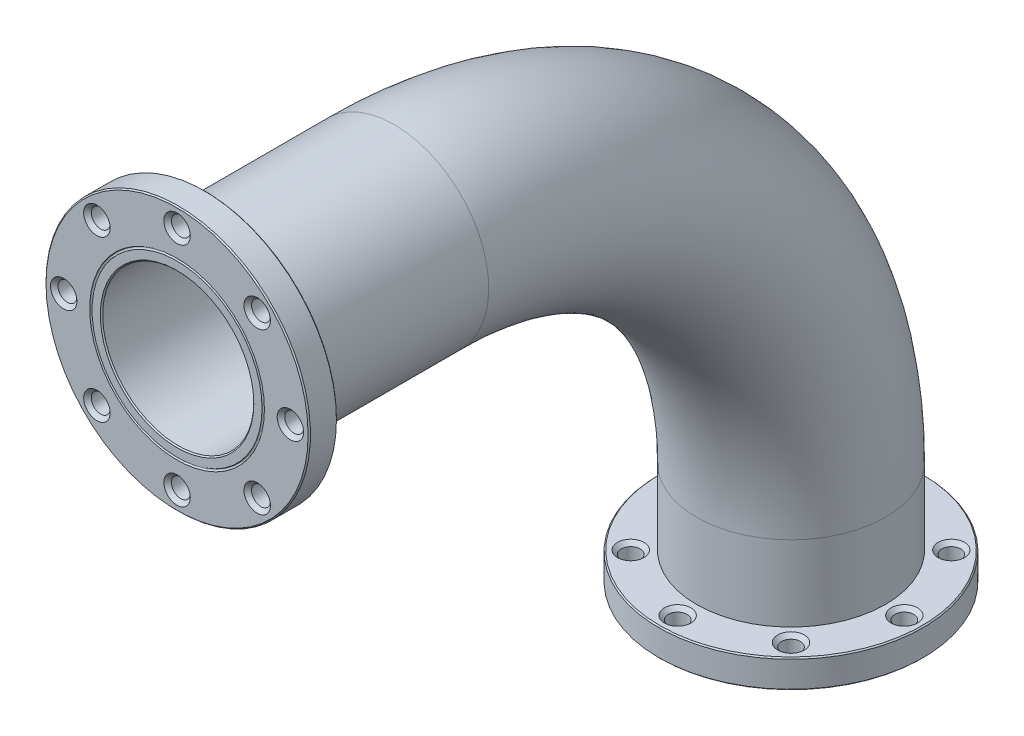
from build123d import *

# Parameters (mm, degrees)
SKETCH1_R           = 88.9
SKETCH1_R_2         = 50.8
BOSS_EXTRUDE1_DEPTH = 19.05
SKETCH3_R           = 6.35
CUT_EXTRUDE1_DEPTH  = 128.158650905
SKETCH4_R           = 63.5
SKETCH4_R_2         = 50.8
BOSS_EXTRUDE2_DEPTH = 50.8
SWEEP1_OUTLINE_R    = 63.5
SWEEP1_OUTLINE_R_2  = 50.8
SWEEP1_ANGLE        = 90
SKETCH8_R           = 63.5
SKETCH8_R_2         = 50.8
BOSS_EXTRUDE3_DEPTH = 127
SKETCH9_R           = 88.9
SKETCH9_R_2         = 50.8
BOSS_EXTRUDE4_DEPTH = 19.05
SKETCH10_R          = 6.35
CUT_EXTRUDE3_DEPTH  = 25.4
CHAMFER1_SIZE       = 0.79375
CHAMFER2_SIZE       = 2.54
CHAMFER3_SIZE       = 2.54
CHAMFER4_SIZE       = 2.54


# Read off the part's stored shape, not the designer's step: Sweep1
with BuildPart() as part:
    # Sketch1 → Boss-Extrude1 (new body)
    with BuildSketch(Plane(origin=(0, 0, 0), x_dir=(1, 0, 0), z_dir=(0, 1, 0))):
        with Locations(Location((0, 0, 0), (0, 0, 90))):
            Circle(SKETCH1_R)
        with Locations(Location((0, 0, 0), (0, 0, 90))):
            Circle(SKETCH1_R_2, mode=Mode.SUBTRACT)
    extrude(amount=BOSS_EXTRUDE1_DEPTH)

    # Sketch2 → Cut-Revolve2 (revolve, cut)
    with BuildSketch(Plane.XY, mode=Mode.PRIVATE) as cut_revolve2_sk:
        with BuildLine():
            Line((-60.325, 0), (-57.15, 0))
            ThreePointArc((-57.15, 0), (-58.7375, 1.5875), (-60.325, 0))
        make_face()
    revolve(cut_revolve2_sk.sketch.rotate(Axis((0, 0, 0), (0, 1, 0)), 270), axis=Axis((0, 0, 0), (0, 1, 0)), mode=Mode.SUBTRACT)

    # Sketch3 → Cut-Extrude1 (cut, through all)
    with BuildSketch(Plane.XZ):
        with Locations(Location((-53.881536726, 53.881536726, 0), (0, 0, 270))):
            Circle(SKETCH3_R)
        with Locations(Location((0, 76.2, 0), (0, 0, 270))):
            Circle(SKETCH3_R)
        with Locations(Location((53.881536726, 53.881536726, 0), (0, 0, 270))):
            Circle(SKETCH3_R)
        with Locations(Location((53.881536726, -53.881536726, 0), (0, 0, 270))):
            Circle(SKETCH3_R)
        with Locations(Location((0, -76.2, 0), (0, 0, 270))):
            Circle(SKETCH3_R)
        with Locations(Location((-53.881536726, -53.881536726, 0), (0, 0, 270))):
            Circle(SKETCH3_R)
        with Locations(Location((-76.2, 0, 0), (0, 0, 270))):
            Circle(SKETCH3_R)
        with Locations(Location((76.2, 0, 0), (0, 0, 270))):
            Circle(SKETCH3_R)
    extrude(amount=-CUT_EXTRUDE1_DEPTH, mode=Mode.SUBTRACT)

    # Sketch4 → Boss-Extrude2 (add)
    with BuildSketch(Plane(origin=(0, 19.05, 0), x_dir=(1, 0, 0), z_dir=(0, 1, 0))):
        with Locations(Location((0, 0, 0), (0, 0, 270))):
            Circle(SKETCH4_R)
        with Locations(Location((0, 0, 0), (0, 0, 90))):
            Circle(SKETCH4_R_2, mode=Mode.SUBTRACT)
    extrude(amount=BOSS_EXTRUDE2_DEPTH)

    # Sweep1 outline → Sweep1 (revolve)
    with BuildSketch(Plane(origin=(0, 69.85, 266.7), x_dir=(0, 0, -1), z_dir=(0, -1, 0))):
        with Locations((266.7, 0)):
            Circle(SWEEP1_OUTLINE_R)
        with Locations((266.7, 0)):
            Circle(SWEEP1_OUTLINE_R_2, mode=Mode.SUBTRACT)
    revolve(axis=Axis((0, 69.85, 266.7), (1, 0, 0)), revolution_arc=SWEEP1_ANGLE)

    # Sketch8 → Boss-Extrude3 (add)
    with BuildSketch(Plane.XY.offset(266.7)):
        with Locations(Location((0, 336.55, 0), (0, 0, 90))):
            Circle(SKETCH8_R)
        with Locations(Location((0, 336.55, 0), (0, 0, 90))):
            Circle(SKETCH8_R_2, mode=Mode.SUBTRACT)
    extrude(amount=BOSS_EXTRUDE3_DEPTH)

    # Sketch9 → Boss-Extrude4 (add)
    with BuildSketch(Plane.XY.offset(393.7)):
        with Locations(Location((0, 336.55, 0), (0, 0, 180))):
            Circle(SKETCH9_R)
        with Locations(Location((0, 336.55, 0), (0, 0, 90))):
            Circle(SKETCH9_R_2, mode=Mode.SUBTRACT)
    extrude(amount=BOSS_EXTRUDE4_DEPTH)

    # Sketch10 → Cut-Extrude3 (cut)
    with BuildSketch(Plane.XY.offset(412.75)):
        with Locations((-76.2, 336.55)):
            Circle(SKETCH10_R)
        with Locations((-53.881536726, 390.431536726)):
            Circle(SKETCH10_R)
        with Locations((0, 412.75)):
            Circle(SKETCH10_R)
        with Locations((53.881536726, 390.431536726)):
            Circle(SKETCH10_R)
        with Locations((76.2, 336.55)):
            Circle(SKETCH10_R)
        with Locations((53.881536726, 282.668463274)):
            Circle(SKETCH10_R)
        with Locations((0, 260.35)):
            Circle(SKETCH10_R)
        with Locations((-53.881536726, 282.668463274)):
            Circle(SKETCH10_R)
    extrude(amount=-CUT_EXTRUDE3_DEPTH, mode=Mode.SUBTRACT)

    # Chamfer1
    chamfer1_edges = [part.edges().sort_by_distance(p)[0] for p in [
        (0, 0, 88.9),
        (0, 19.05, 88.9),
        (0, 0, 50.8),
        (88.9, 336.55, 412.75),
        (88.9, 336.55, 393.7),
        (0, 285.75, 412.75),
    ]]
    chamfer(chamfer1_edges, length=CHAMFER1_SIZE)

    # Chamfer2
    chamfer2_edges = [part.edges().sort_by_distance(p)[0] for p in [
        (47.531536726, 282.668463274, 412.75),
        (-6.35, 260.35, 412.75),
        (-60.231536726, 282.668463274, 412.75),
        (0, 0, 82.55),
        (53.881536726, 0, 60.231536726),
        (53.881536726, 0, -47.531536726),
        (0, 0, -69.85),
        (-53.881536726, 0, -47.531536726),
        (-76.2, 0, 6.35),
        (76.2, 0, 6.35),
        (-53.881536726, 0, 60.231536726),
        (-82.55, 336.55, 412.75),
        (-6.35, 412.75, 412.75),
        (-60.231536726, 390.431536726, 412.75),
        (47.531536726, 390.431536726, 412.75),
        (69.85, 336.55, 412.75),
    ]]
    chamfer(chamfer2_edges, length=CHAMFER2_SIZE)

    # Chamfer3
    chamfer3_edges = [part.edges().sort_by_distance(p)[0] for p in [
        (0, 19.05, 82.55),
        (53.881536726, 19.05, 60.231536726),
        (53.881536726, 19.05, -47.531536726),
        (0, 19.05, -69.85),
        (-53.881536726, 19.05, -47.531536726),
        (-76.2, 19.05, 6.35),
        (76.2, 19.05, 6.35),
        (-53.881536726, 19.05, 60.231536726),
    ]]
    chamfer(chamfer3_edges, length=CHAMFER3_SIZE)

    # Chamfer4
    chamfer4_edges = [part.edges().sort_by_distance(p)[0] for p in [
        (47.531536726, 282.668463274, 393.7),
        (-6.35, 260.35, 393.7),
        (-60.231536726, 282.668463274, 393.7),
        (-82.55, 336.55, 393.7),
        (-6.35, 412.75, 393.7),
        (-60.231536726, 390.431536726, 393.7),
        (47.531536726, 390.431536726, 393.7),
        (69.85, 336.55, 393.7),
    ]]
    chamfer(chamfer4_edges, length=CHAMFER4_SIZE)

    # Sketch11 → Cut-Revolve3 (revolve, cut)
    with BuildSketch(Plane(origin=(0, 0, 0), x_dir=(0, 0, -1), z_dir=(1, 0, 0)), mode=Mode.PRIVATE) as cut_revolve3_sk:
        with BuildLine():
            Line((-412.75, 393.7), (-412.75, 395.2875))
            ThreePointArc((-412.75, 395.2875), (-411.95625, 394.49375), (-412.75, 393.7))
        make_face()
    revolve(cut_revolve3_sk.sketch.rotate(Axis((0, 336.55, 412.75), (0, 0, -1)), 90), axis=Axis((0, 336.55, 412.75), (0, 0, -1)), mode=Mode.SUBTRACT)


solid = part.part
